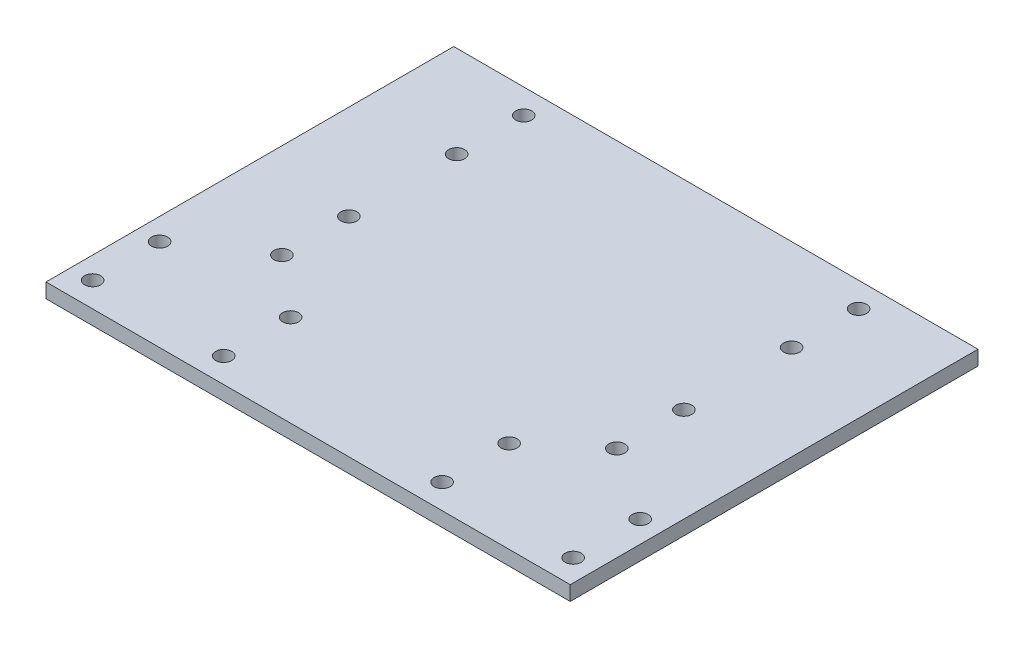
from build123d import *

# Parameters (mm, degrees)
SKETCH1_W   = 180
SKETCH1_H   = 140
BODY_DEPTH  = 5
SKETCH2_R   = 2.75
HOLES_DEPTH = 115.127122105


with BuildPart() as part:
    # Sketch1 → Body (new body)
    with BuildSketch(Plane(origin=(0, 0, 0), x_dir=(1, 0, 0), z_dir=(0, 1, 0))):
        Rectangle(SKETCH1_W, SKETCH1_H)
    extrude(amount=BODY_DEPTH)

    # Sketch2 → Holes (cut, through all)
    with BuildSketch(Plane(origin=(0, 5, 0), x_dir=(1, 0, 0), z_dir=(0, 1, 0))):
        with Locations((-57.5, 61.5)):
            Circle(SKETCH2_R)
        with Locations((-57.5, 38.5)):
            Circle(SKETCH2_R)
        with Locations((-57.5, 1.5)):
            Circle(SKETCH2_R)
        with Locations((-57.5, -21.5)):
            Circle(SKETCH2_R)
        with Locations((-82.5, -38.5)):
            Circle(SKETCH2_R)
        with Locations((-82.5, -61.5)):
            Circle(SKETCH2_R)
        with Locations((-37.5, -61.5)):
            Circle(SKETCH2_R)
        with Locations((-37.5, -38.5)):
            Circle(SKETCH2_R)
        with Locations((37.5, -38.5)):
            Circle(SKETCH2_R)
        with Locations((37.5, -61.5)):
            Circle(SKETCH2_R)
        with Locations((82.5, -61.5)):
            Circle(SKETCH2_R)
        with Locations((82.5, -38.5)):
            Circle(SKETCH2_R)
        with Locations((57.5, -21.5)):
            Circle(SKETCH2_R)
        with Locations((57.5, 1.5)):
            Circle(SKETCH2_R)
        with Locations((57.5, 38.5)):
            Circle(SKETCH2_R)
        with Locations((57.5, 61.5)):
            Circle(SKETCH2_R)
    extrude(amount=-HOLES_DEPTH, mode=Mode.SUBTRACT)


solid = part.part
